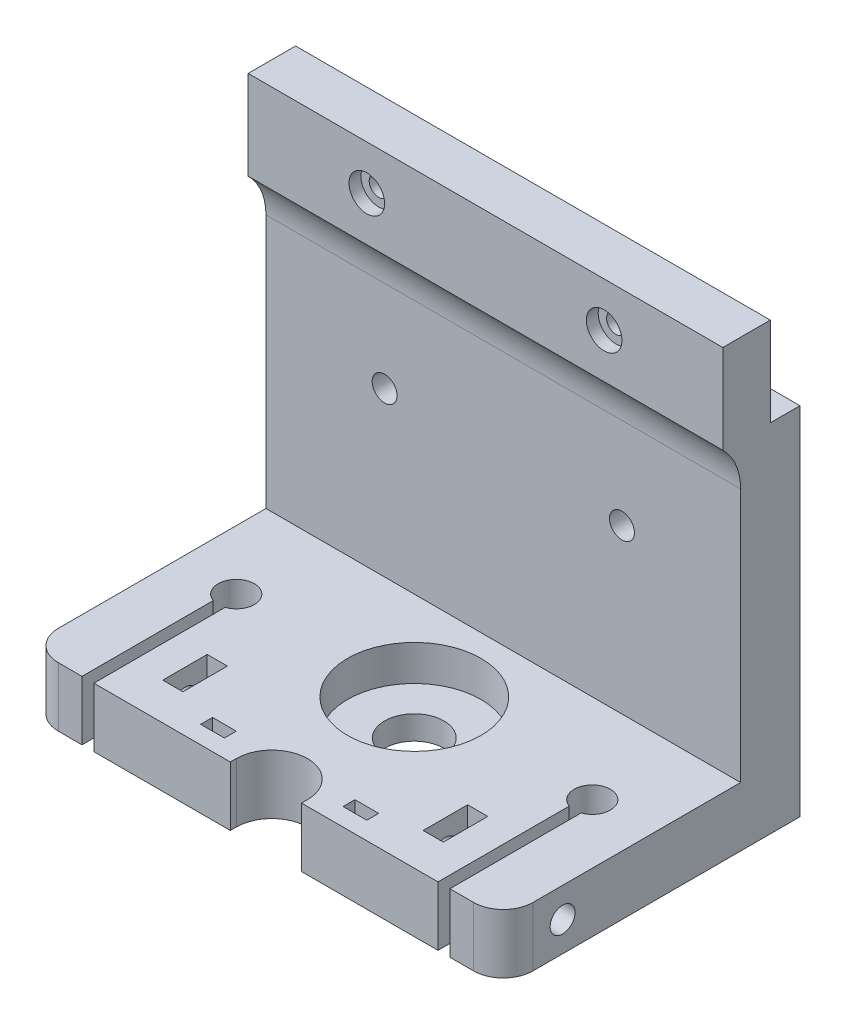
from build123d import *

# Parameters (mm, degrees)
SKETCH_1_W           = 80
SKETCH_1_H           = 150
EXTRUDE_1_DEPTH      = 10
SKETCH_4_R           = 11.25
EXTRUDE_3_DEPTH      = 10
SKETCH_5_R           = 11.25
SKETCH_5_R_2         = 5
EXTRUDE_4_DEPTH      = 4
SKETCH_6_R           = 2.1
CUT_EXTRUDE_1_DEPTH  = 24
SKETCH_7_W           = 3.4
SKETCH_7_H           = 7.5
CUT_EXTRUDE_2_DEPTH  = 24
CUT_EXTRUDE_START    = -24
SKETCH_8_R           = 2.1
CUT_EXTRUDE_3_DEPTH  = 24
SKETCH_9_W           = 80
SKETCH_9_H           = 40
SKETCH_9_R           = 11
SKETCH_9_R_2         = 1.6
EXTRUDE_5_DEPTH      = 10
FILLET_1_R           = 5
CUT_EXTRUDE_START_2  = -10
SKETCH_10_W          = 3.4
SKETCH_10_H          = 7.5
CUT_EXTRUDE_5_DEPTH  = 10
SKETCH_11_R          = 2.1
CUT_EXTRUDE_6_DEPTH  = 24
SKETCH_12_R          = 2.1
CUT_EXTRUDE_7_DEPTH  = 24
SKETCH_14_W          = 4
SKETCH_14_H          = 2
CUT_EXTRUDE_9_DEPTH  = 10
SKETCH_16_R          = 2.1
CUT_EXTRUDE_10_DEPTH = 94.94147114
CUT_EXTRUDE_11_DEPTH = 121.519707932
SKETCH_18_W          = 3
SKETCH_18_H          = 15
EXTRUDE_7_DEPTH      = 80
FILLET_2_R           = 10
SKETCH_19_R          = 1.6
CUT_EXTRUDE_12_DEPTH = 80
SKETCH_20_R          = 3
CUT_EXTRUDE_13_DEPTH = 2


with BuildPart() as part:
    # 草圖1 → 填料-伸長1 (new body)
    with BuildSketch(Plane.XY):
        Rectangle(SKETCH_1_W, SKETCH_1_H)
    extrude(amount=EXTRUDE_1_DEPTH)

    # 草圖4 → 填料-伸長3 (add)
    with BuildSketch(Plane.XZ.offset(75)):
        with BuildLine():
            ThreePointArc((-6, 49), (0, 43), (6, 49))
            Line((6, 49), (6, 50))
            Line((6, 50), (29, 50))
            Line((29, 50), (29, 27.881405907))
            ThreePointArc((29, 27.881405907), (30, 21.95), (31, 27.881405907))
            Line((31, 27.881405907), (31, 50))
            Line((31, 50), (40, 50))
            Line((40, 50), (40, 10))
            Line((40, 10), (-40, 10))
            Line((-40, 10), (-40, 50))
            Line((-40, 50), (-31, 50))
            Line((-31, 50), (-31, 27.881405907))
            ThreePointArc((-31, 27.881405907), (-30, 21.95), (-29, 27.881405907))
            Line((-29, 27.881405907), (-29, 50))
            Line((-29, 50), (-6, 50))
            Line((-6, 50), (-6, 49))
        make_face()
        with Locations(Location((0, 25, 0), (0, 0, 270))):
            Circle(SKETCH_4_R, mode=Mode.SUBTRACT)
    extrude(amount=-EXTRUDE_3_DEPTH)

    # 草圖5 → 填料-伸長4 (add)
    with BuildSketch(Plane.XZ.offset(75)):
        with Locations(Location((0, 25, 0), (0, 0, 270))):
            Circle(SKETCH_5_R)
        with Locations(Location((0, 25, 0), (0, 0, 270))):
            Circle(SKETCH_5_R_2, mode=Mode.SUBTRACT)
    extrude(amount=-EXTRUDE_4_DEPTH)

    # 草圖6 → 除料-伸長1 (cut)
    with BuildSketch(Plane(origin=(40, 0, 0), x_dir=(0, 0, -1), z_dir=(1, 0, 0))):
        with Locations(Location((-40, -70, 0), (0, 0, 90))):
            Circle(SKETCH_6_R)
    extrude(amount=-CUT_EXTRUDE_1_DEPTH, mode=Mode.SUBTRACT)

    # 草圖7 → 除料-伸長2 (cut)
    with BuildSketch(Plane.XZ.offset(75)):
        with Locations((-21.943112787, 40)):
            Rectangle(SKETCH_7_W, SKETCH_7_H)
        with Locations((21.943112787, 40)):
            Rectangle(SKETCH_7_W, SKETCH_7_H)
    extrude(amount=-CUT_EXTRUDE_2_DEPTH, mode=Mode.SUBTRACT)

    # 草圖8 → 除料-伸長3 (cut)
    with BuildSketch(Plane.ZY.offset(40).offset(CUT_EXTRUDE_START)):
        with Locations(Location((40, -70, 0), (0, 0, 180))):
            Circle(SKETCH_8_R)
    extrude(amount=CUT_EXTRUDE_3_DEPTH, mode=Mode.SUBTRACT)

    # 草圖9 → 填料-伸長5 (add)
    with BuildSketch(Plane(origin=(0, 75, 0), x_dir=(1, 0, 0), z_dir=(0, 1, 0))):
        with Locations((0, -30)):
            Rectangle(SKETCH_9_W, SKETCH_9_H)
        with Locations(Location((0, -25, 0), (0, 0, 270))):
            Circle(SKETCH_9_R, mode=Mode.SUBTRACT)
        with Locations(Location((-21.920310217, -25, 0), (0, 0, 270))):
            Circle(SKETCH_9_R_2, mode=Mode.SUBTRACT)
        with Locations(Location((0, -46.920310217, 0), (0, 0, 270))):
            Circle(SKETCH_9_R_2, mode=Mode.SUBTRACT)
        with Locations(Location((21.920310217, -25, 0), (0, 0, 270))):
            Circle(SKETCH_9_R_2, mode=Mode.SUBTRACT)
    extrude(amount=-EXTRUDE_5_DEPTH)

    # 圓角1
    fillet_1_edges = [part.edges().sort_by_distance(p)[0] for p in [
        (40, 70, 50),
        (-40, 70, 50),
        (40, -70, 50),
        (-40, -70, 50),
    ]]
    fillet(fillet_1_edges, radius=FILLET_1_R)

    # 草圖10 → 除料-伸長5 (cut)
    with BuildSketch(Plane(origin=(0, 75, 0), x_dir=(1, 0, 0), z_dir=(0, 1, 0)).offset(CUT_EXTRUDE_START_2)):
        with BuildLine():
            Line((-30.992105359, -72.117230176), (-29, -72.117230176))
            Line((-29, -72.117230176), (-29, -27.881405907))
            ThreePointArc((-29, -27.881405907), (-30.004176302, -21.950002859), (-30.992105359, -27.884133658))
            Line((-30.992105359, -27.884133658), (-30.992105359, -72.117230176))
        make_face()
        with BuildLine():
            Line((29.001577897, -72.118320527), (31, -72.118320527))
            Line((31, -72.118320527), (31, -27.881405907))
            ThreePointArc((31, -27.881405907), (29.999164969, -21.950000114), (29.001577897, -27.881953036))
            Line((29.001577897, -27.881953036), (29.001577897, -72.118320527))
        make_face()
        with Locations((-21.943112787, -40)):
            Rectangle(SKETCH_10_W, SKETCH_10_H)
        with Locations((21.943112787, -40)):
            Rectangle(SKETCH_10_W, SKETCH_10_H)
    extrude(amount=CUT_EXTRUDE_5_DEPTH, mode=Mode.SUBTRACT)

    # 草圖11 → 除料-伸長6 (cut)
    with BuildSketch(Plane(origin=(40, 0, 0), x_dir=(0, 0, -1), z_dir=(1, 0, 0))):
        with Locations((-40, 70)):
            Circle(SKETCH_11_R)
    extrude(amount=-CUT_EXTRUDE_6_DEPTH, mode=Mode.SUBTRACT)

    # 草圖12 → 除料-伸長7 (cut)
    with BuildSketch(Plane.ZY.offset(40).offset(CUT_EXTRUDE_START)):
        with Locations(Location((40, 70, 0), (0, 0, 180))):
            Circle(SKETCH_12_R)
    extrude(amount=CUT_EXTRUDE_7_DEPTH, mode=Mode.SUBTRACT)

    # 草圖14 → 除料-伸長9 (cut)
    with BuildSketch(Plane.XZ.offset(75)):
        with Locations((-12, 46)):
            Rectangle(SKETCH_14_W, SKETCH_14_H)
        with Locations((12, 46)):
            Rectangle(SKETCH_14_W, SKETCH_14_H)
    extrude(amount=-CUT_EXTRUDE_9_DEPTH, mode=Mode.SUBTRACT)

    # 草圖16 → 除料-伸長10 (cut, through all)
    with BuildSketch(Plane.XY.offset(10)):
        with Locations((-20, 37.5)):
            Circle(SKETCH_16_R)
        with Locations((20, 37.5)):
            Circle(SKETCH_16_R)
        with Locations((20, -37.5)):
            Circle(SKETCH_16_R)
        with Locations((-20, -37.5)):
            Circle(SKETCH_16_R)
    extrude(amount=-CUT_EXTRUDE_10_DEPTH, mode=Mode.SUBTRACT)

    # 草圖17 → 除料-伸長11 (cut, through all)
    with BuildSketch(Plane(origin=(40, 0, 0), x_dir=(0, 0, -1), z_dir=(1, 0, 0))):
        Polygon((-5, 0), (-5, -15), (0, -15), (0, 75), (-50, 75), (-50, 65), (-10, 65), (-10, 0), align=None)
    extrude(amount=-CUT_EXTRUDE_11_DEPTH, mode=Mode.SUBTRACT)

    # 草圖18 → 填料-伸長7 (add)
    with BuildSketch(Plane(origin=(40, 0, 0), x_dir=(0, 0, -1), z_dir=(1, 0, 0))):
        with Locations((-11.5, -7.5)):
            Rectangle(SKETCH_18_W, SKETCH_18_H)
    extrude(amount=-EXTRUDE_7_DEPTH)

    # 圓角2
    # the kernel refuses this fillet: 10 mm, written as the material it adds along each edge
    with BuildSketch(Plane(origin=(40, -15, 10), x_dir=(0, 0, 1), z_dir=(-1, 0, 0))) as fillet_2_piece_1:
        with BuildLine():
            CenterArc((10, -7.141428429), FILLET_2_R, 134.427004001, 45.572995999)
            Line((0, -7.141428429), (-0.2, -7.141428429))
            Line((-0.2, -7.141428429), (-0.2, 0))
            Line((-0.2, 0), (0, 0.2))
            ThreePointArc((0, 0.2), (1.5, 0.2), (2.86, 0.142828569))
            Line((2.86, 0.142828569), (3, 0))
        make_face()
    extrude(amount=80)

    # 草圖19 → 除料-伸長12 (cut)
    with BuildSketch(Plane.XY.offset(13)):
        with Locations((-20, -7.5)):
            Circle(SKETCH_19_R)
        with Locations(Location((20, -7.5, 0), (0, 0, 270))):
            Circle(SKETCH_19_R)
    extrude(amount=-CUT_EXTRUDE_12_DEPTH, mode=Mode.SUBTRACT)

    # 草圖20 → 除料-伸長13 (cut)
    with BuildSketch(Plane.XY.offset(13)):
        with Locations((-20, -7.5)):
            Circle(SKETCH_20_R)
        with Locations((20, -7.5)):
            Circle(SKETCH_20_R)
    extrude(amount=-CUT_EXTRUDE_13_DEPTH, mode=Mode.SUBTRACT)


solid = part.part
